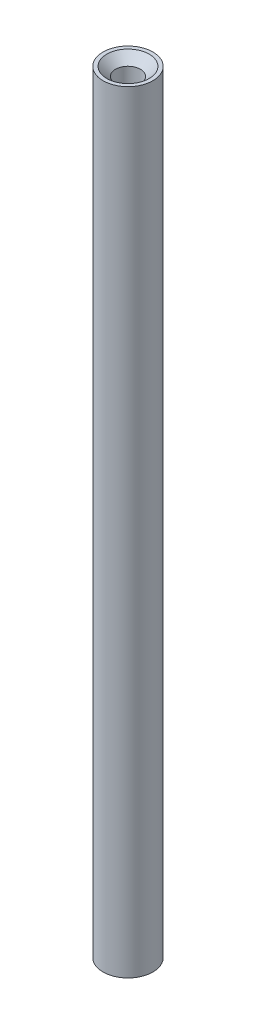
from build123d import *

# Parameters (mm, degrees)
SKETCH1_R           = 2
SKETCH1_R_2         = 1
BOSS_EXTRUDE1_DEPTH = 62
CHAMFER1_SIZE       = 0.7


with BuildPart() as part:
    # Sketch1 → Boss-Extrude1 (new body)
    with BuildSketch(Plane(origin=(0, 0, 0), x_dir=(1, 0, 0), z_dir=(0, 1, 0))):
        Circle(SKETCH1_R)
        Circle(SKETCH1_R_2, mode=Mode.SUBTRACT)
    extrude(amount=BOSS_EXTRUDE1_DEPTH)

    # Chamfer1
    chamfer1_edges = [part.edges().sort_by_distance(p)[0] for p in [
        (-1, 62, 0),
    ]]
    chamfer(chamfer1_edges, length=CHAMFER1_SIZE)


solid = part.part
